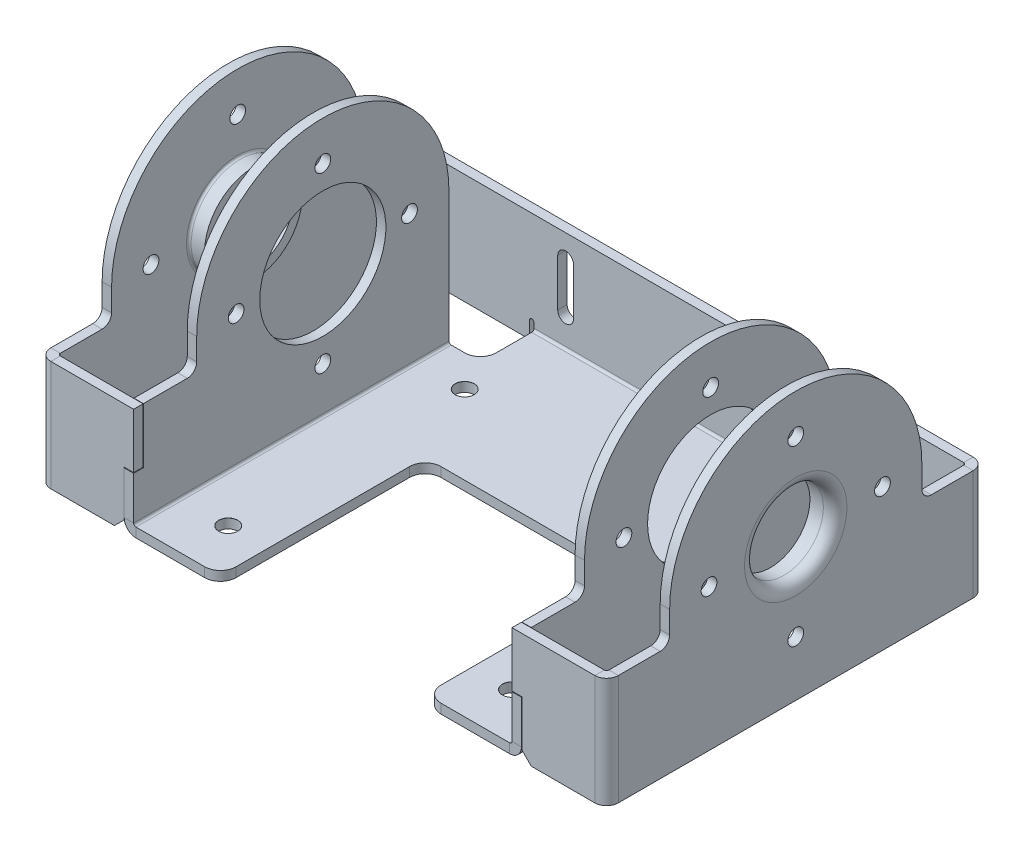
from build123d import *

# Parameters (mm, degrees)
SKETCH2_R                         = 12.5
BASE_FLANGE1_DEPTH                = 3
EDGE_FLANGE1_STRIP_W              = 13.4732
EDGE_FLANGE1_STRIP_H              = 3
EDGE_FLANGE1_STRIP_CUT_DEPTH      = 35
EDGE_FLANGE1_DEPTH                = 35
EDGE_FLANGE2_STRIP_W              = 13.4732
EDGE_FLANGE2_STRIP_H              = 3
EDGE_FLANGE2_STRIP_CUT_DEPTH      = 35
EDGE_FLANGE2_DEPTH                = 35
EDGE_FLANGE3_DEPTH                = 51.5
EDGE_FLANGE3_2_DEPTH              = 50
EDGE_FLANGE3_START                = -61
EDGE_FLANGE3_3_DEPTH              = 4.7366
BASE_FLANGE2_START                = -3
SKETCH16_R                        = 20
BASE_FLANGE2_DEPTH                = 3
SKETCH19_W                        = 3
SKETCH19_H                        = 17.5
CUT_EXTRUDE1_DEPTH                = 10
SKETCH20_W                        = 3
SKETCH20_H                        = 17.5
CUT_EXTRUDE2_DEPTH                = 3
MOVE_FACE1_BY                     = 0.1
MOVE_FACE1_2_BY                   = 0.1
MOVE_FACE2_BY                     = 0.1
MOVE_FACE2_2_BY                   = 0.1
EDGE_FLANGE4_STRIP_W              = 13.4732
EDGE_FLANGE4_STRIP_H              = 3
EDGE_FLANGE4_STRIP_CUT_DEPTH      = 100
EDGE_FLANGE4_DEPTH                = 100
SKETCH34_W                        = 65
SKETCH34_H                        = 65
CUT_EXTRUDE3_DEPTH                = 3
F_6_0_6_DIAMETER_HOLE1_AT_2_COUNT = 2
F_6_0_6_DIAMETER_HOLE1_AT_2_PITCH = 75
F_6_0_6_DIAMETER_HOLE1_AT_3_COUNT = 2
F_6_0_6_DIAMETER_HOLE1_AT_3_PITCH = 117.153745139
F_6_0_6_DIAMETER_HOLE1_AT_4_COUNT = 2
F_6_0_6_DIAMETER_HOLE1_AT_4_PITCH = 90
CUT_EXTRUDE4_DEPTH                = 3
SKETCH44_R                        = 2.5
CUT_EXTRUDE5_DEPTH                = 208.906228863
CIRPATTERN1_COUNT                 = 4
BREAK_CORNER1_START               = -1
BREAK_CORNER1_DEPTH               = 5
BREAK_CORNER1_2_DEPTH             = 3
BREAK_CORNER2_START               = -90
BREAK_CORNER2_DEPTH               = 3
BREAK_CORNER2_START_2             = 87
BREAK_CORNER2_2_DEPTH             = 3
BREAK_CORNER2_START_3             = -63
BREAK_CORNER2_3_DEPTH             = 3
BREAK_CORNER2_START_4             = 60
BREAK_CORNER2_4_DEPTH             = 3
BREAK_CORNER3_START               = 56
BREAK_CORNER3_DEPTH               = 5


with BuildPart() as part:
    # Base-Flange1: sheet metal written as solids
    # Sketch2 → Base-Flange1 (new body)
    with BuildSketch(Plane(origin=(90, 0, 0), x_dir=(0, 0, -1), z_dir=(1, 0, 0))):
        with BuildLine():
            Line((-60, 0), (60, 0))
            Line((60, 0), (60, 35))
            Line((60, 35), (40, 35))
            Line((40, 35), (40, 45))
            ThreePointArc((40, 45), (0, 85), (-40, 45))
            Line((-40, 45), (-40, 35))
            Line((-40, 35), (-60, 35))
            Line((-60, 35), (-60, 0))
        make_face()
        with Locations((0, 45)):
            Circle(SKETCH2_R, mode=Mode.SUBTRACT)
    extrude(amount=-BASE_FLANGE1_DEPTH)

    # Edge-Flange1: sheet metal written as solids
    # Edge-Flange1 strip (on a plane across the edge) → Edge-Flange1 strip cut (cut)
    with BuildSketch(Plane(origin=(87, 35, -60), x_dir=(0, 0, 1), z_dir=(0, -1, 0))):
        with Locations((-3, -1.5)):
            Rectangle(EDGE_FLANGE1_STRIP_W, EDGE_FLANGE1_STRIP_H)
    extrude(amount=EDGE_FLANGE1_STRIP_CUT_DEPTH, mode=Mode.SUBTRACT)

    # Edge-Flange1 section (on a plane across the edge) → Edge-Flange1 (add)
    with BuildSketch(Plane(origin=(87, 35, -60), x_dir=(0, 0, 1), z_dir=(0, -1, 0))):
        with BuildLine():
            Line((0, 0.7366), (0, 87))
            Line((0, 87), (3, 87))
            Line((3, 87), (3, 0.7366))
            ThreePointArc((3, 0.7366), (3.215745145, 0.215745145), (3.7366, 0))
            Line((3.7366, 0), (3.7366, -3))
            ThreePointArc((3.7366, -3), (1.094424801, -1.905575199), (0, 0.7366))
        make_face()
    extrude(amount=EDGE_FLANGE1_DEPTH)

    # Edge-Flange2: sheet metal written as solids
    # Edge-Flange2 strip (on a plane across the edge) → Edge-Flange2 strip cut (cut)
    with BuildSketch(Plane(origin=(87, 0, 60), x_dir=(0, 0, -1), z_dir=(0, 1, 0))):
        with Locations((-3, -1.5)):
            Rectangle(EDGE_FLANGE2_STRIP_W, EDGE_FLANGE2_STRIP_H)
    extrude(amount=EDGE_FLANGE2_STRIP_CUT_DEPTH, mode=Mode.SUBTRACT)

    # Edge-Flange2 section (on a plane across the edge) → Edge-Flange2 (add)
    with BuildSketch(Plane(origin=(87, 0, 60), x_dir=(0, 0, -1), z_dir=(0, 1, 0))):
        with BuildLine():
            Line((0, 0.7366), (0, 27))
            Line((0, 27), (3, 27))
            Line((3, 27), (3, 0.7366))
            ThreePointArc((3, 0.7366), (3.215745145, 0.215745145), (3.7366, 0))
            Line((3.7366, 0), (3.7366, -3))
            ThreePointArc((3.7366, -3), (1.094424801, -1.905575199), (0, 0.7366))
        make_face()
    extrude(amount=EDGE_FLANGE2_DEPTH)

    # Edge-Flange3: read off the stored shape, not the designer's step
    # Edge-Flange3 outline → Edge-Flange3 (cut)
    with BuildSketch(Plane.YZ):
        with BuildLine():
            ThreePointArc((3.7366, -60), (1.369132999, -59.154295979), (0.073322778, -57))
            Line((0.073322778, -57), (0, -57))
            Line((0, -57), (0, -60))
            Line((0, -60), (3.7366, -60))
        make_face()
    extrude(amount=EDGE_FLANGE3_DEPTH, mode=Mode.SUBTRACT)

    # Edge-Flange3 2 outline → Edge-Flange3 2 (add)
    with BuildSketch(Plane.YZ):
        with BuildLine():
            Line((0, 60), (0, -56.2634))
            ThreePointArc((0, -56.2634), (0.018375879, -56.63352018), (0.073322778, -57))
            Line((0.073322778, -57), (3.7366, -57))
            ThreePointArc((3.7366, -57), (3.215745145, -56.784254855), (3, -56.2634))
            Line((3, -56.2634), (3, 60))
            Line((3, 60), (0, 60))
        make_face()
    extrude(amount=EDGE_FLANGE3_2_DEPTH)

    # Edge-Flange3 3 outline → Edge-Flange3 3 (cut)
    with BuildSketch(Plane.XY.offset(EDGE_FLANGE3_START)):
        with BuildLine():
            Line((51.5, -1), (51.5, 5.2366))
            ThreePointArc((51.5, 5.2366), (50.75, 5.9866), (50, 5.2366))
            Line((50, 5.2366), (50, -1))
            Line((50, -1), (51.5, -1))
        make_face()
    extrude(amount=EDGE_FLANGE3_3_DEPTH, mode=Mode.SUBTRACT)

    # Sketch20 → Cut-Extrude2 (cut)
    with BuildSketch(Plane.XY.offset(60)):
        with Locations((61.5, 8.75)):
            Rectangle(SKETCH20_W, SKETCH20_H)
    extrude(amount=-CUT_EXTRUDE2_DEPTH, mode=Mode.SUBTRACT)

    # Move Face2: a face moved inward by 0.1
    extrude(part.faces().sort_by_distance((63, 8.75, 58.5))[0], amount=MOVE_FACE2_BY, dir=(1, 0, 0), mode=Mode.SUBTRACT)

    # Move Face2 2: a face moved inward by 0.1
    extrude(part.faces().sort_by_distance((61.5, 17.5, 58.5))[0], amount=MOVE_FACE2_2_BY, dir=(0, 1, 0), mode=Mode.SUBTRACT)


with BuildPart() as body_2:
    # Base-Flange2: sheet metal written as solids
    # Sketch16 → Base-Flange2 (new body)
    with BuildSketch(Plane.ZY.offset(-60).offset(BASE_FLANGE2_START)):
        with BuildLine():
            Line((60, 0), (-40, 0))
            Line((-40, 0), (-40, 45))
            ThreePointArc((-40, 45), (0, 85), (40, 45))
            Line((40, 45), (40, 35))
            Line((40, 35), (60, 35))
            Line((60, 35), (60, 0))
        make_face()
        with Locations((0, 45)):
            Circle(SKETCH16_R, mode=Mode.SUBTRACT)
    extrude(amount=BASE_FLANGE2_DEPTH)

    # Sketch19 → Cut-Extrude1 (cut)
    with BuildSketch(Plane.ZY.offset(-60)):
        with Locations((58.5, 26.25)):
            Rectangle(SKETCH19_W, SKETCH19_H)
    extrude(amount=-CUT_EXTRUDE1_DEPTH, mode=Mode.SUBTRACT)

    # Move Face1: a face moved inward by 0.1
    extrude(body_2.faces().sort_by_distance((61.5, 17.5, 58.5))[0], amount=MOVE_FACE1_BY, dir=(0, -1, 0), mode=Mode.SUBTRACT)

    # Move Face1 2: a face moved inward by 0.1
    extrude(body_2.faces().sort_by_distance((61.5, 26.25, 57))[0], amount=MOVE_FACE1_2_BY, dir=(0, 0, -1), mode=Mode.SUBTRACT)

    # Edge-Flange4: sheet metal written as solids
    # Edge-Flange4 strip (on a plane across the edge) → Edge-Flange4 strip cut (cut)
    with BuildSketch(Plane(origin=(60, 0, -40), x_dir=(0, 1, 0), z_dir=(0, 0, 1))):
        with Locations((-3, -1.5)):
            Rectangle(EDGE_FLANGE4_STRIP_W, EDGE_FLANGE4_STRIP_H)
    extrude(amount=EDGE_FLANGE4_STRIP_CUT_DEPTH, mode=Mode.SUBTRACT)

    # Edge-Flange4 section (on a plane across the edge) → Edge-Flange4 (add)
    with BuildSketch(Plane(origin=(60, 0, -40), x_dir=(0, 1, 0), z_dir=(0, 0, 1))):
        with BuildLine():
            Line((0, 0.7366), (0, 27))
            Line((0, 27), (3, 27))
            Line((3, 27), (3, 0.7366))
            ThreePointArc((3, 0.7366), (3.215745145, 0.215745145), (3.7366, 0))
            Line((3.7366, 0), (3.7366, -3))
            ThreePointArc((3.7366, -3), (1.094424801, -1.905575199), (0, 0.7366))
        make_face()
    extrude(amount=EDGE_FLANGE4_DEPTH)

    # Combine1: union part
    add(part.part)


with BuildPart() as body_2_2:
    # Mirror1: mirrored copy
    add(body_2.part.mirror(Plane(origin=(0, 0, 0), x_dir=(0, 0, 1), z_dir=(1, 0, 0))))

    # Combine2: union body 2
    add(body_2.part)

    # Sketch34 → Cut-Extrude3 (cut)
    with BuildSketch(Plane(origin=(0, 3, 0), x_dir=(1, 0, 0), z_dir=(0, 1, 0))):
        with Locations((0, -27.5)):
            Rectangle(SKETCH34_W, SKETCH34_H)
    extrude(amount=-CUT_EXTRUDE3_DEPTH, mode=Mode.SUBTRACT)

    # Sketch36 → Ø6.0 (6) Diameter Hole1 (revolve, cut)
    with BuildSketch(Plane(origin=(-45, 3, 45), x_dir=(0, 0, 1), z_dir=(1, 0, 0))):
        Polygon((0, 0), (0, 3), (3, 3), (3, 0.025), (3.025, 0), align=None)
    f_6_0_6_diameter_hole1 = revolve(axis=Axis((-45, 9.35, 45), (0, -1, 0)), mode=Mode.SUBTRACT)

    # Ø6.0 (6) Diameter Hole1 at 2: Ø6.0 (6) Diameter Hole1 ×2
    with Locations(*[(0, 0, -i * F_6_0_6_DIAMETER_HOLE1_AT_2_PITCH) for i in range(1, F_6_0_6_DIAMETER_HOLE1_AT_2_COUNT)]):
        add(f_6_0_6_diameter_hole1, mode=Mode.SUBTRACT)

    # Ø6.0 (6) Diameter Hole1 at 3: Ø6.0 (6) Diameter Hole1 ×2
    with Locations(*[Vector(0.7682212795973759, -3.070429029417624e-15, -0.6401843996644798) * (i * F_6_0_6_DIAMETER_HOLE1_AT_3_PITCH) for i in range(1, F_6_0_6_DIAMETER_HOLE1_AT_3_COUNT)]):
        add(f_6_0_6_diameter_hole1, mode=Mode.SUBTRACT)

    # Ø6.0 (6) Diameter Hole1 at 4: Ø6.0 (6) Diameter Hole1 ×2
    with Locations(*[(i * F_6_0_6_DIAMETER_HOLE1_AT_4_PITCH, 0, 0) for i in range(1, F_6_0_6_DIAMETER_HOLE1_AT_4_COUNT)]):
        add(f_6_0_6_diameter_hole1, mode=Mode.SUBTRACT)

    # Sketch37 → Cut-Extrude4 (cut)
    with BuildSketch(Plane.XY.offset(-57)):
        with BuildLine():
            Line((-42.5, 12.5), (-42.5, 27.5))
            ThreePointArc((-42.5, 27.5), (-40, 30), (-37.5, 27.5))
            Line((-37.5, 27.5), (-37.5, 12.5))
            ThreePointArc((-37.5, 12.5), (-40, 10), (-42.5, 12.5))
        make_face()
        with BuildLine():
            Line((42.5, 12.5), (42.5, 27.5))
            ThreePointArc((42.5, 27.5), (40, 30), (37.5, 27.5))
            Line((37.5, 27.5), (37.5, 12.5))
            ThreePointArc((37.5, 12.5), (40, 10), (42.5, 12.5))
        make_face()
    extrude(amount=-CUT_EXTRUDE4_DEPTH, mode=Mode.SUBTRACT)

    # Edge-Flange5: read off the stored shape, not the designer's step
    # Edge-Flange5 outline → Edge-Flange5 (revolve, cut)
    with BuildSketch(Plane(origin=(0, 45, 0), x_dir=(0, 1, 0), z_dir=(0, 0, -1))):
        with BuildLine():
            Line((12.5, 87), (12.573322778, 87))
            ThreePointArc((12.573322778, 87), (13.869132999, 89.154295979), (16.2366, 90))
            Line((16.2366, 90), (12.5, 90))
            Line((12.5, 90), (12.5, 87))
        make_face()
    revolve(axis=Axis((0, 45, 0), (1, 0, 0)), mode=Mode.SUBTRACT)

    # Edge-Flange5 2 outline → Edge-Flange5 2 (revolve)
    with BuildSketch(Plane(origin=(0, 45, 0), x_dir=(0, 1, 0), z_dir=(0, 0, -1))):
        with BuildLine():
            Line((12.5, 86.2634), (12.5, 82))
            Line((12.5, 82), (15.5, 82))
            Line((15.5, 82), (15.5, 86.2634))
            ThreePointArc((15.5, 86.2634), (15.715745145, 86.784254855), (16.2366, 87))
            Line((16.2366, 87), (12.573322778, 87))
            ThreePointArc((12.573322778, 87), (12.518375879, 86.63352018), (12.5, 86.2634))
        make_face()
    revolve(axis=Axis((0, 45, 0), (1, 0, 0)))

    # Edge-Flange6: read off the stored shape, not the designer's step
    # Edge-Flange6 outline → Edge-Flange6 (revolve, cut)
    with BuildSketch(Plane(origin=(0, 45, 0), x_dir=(0, 1, 0), z_dir=(0, 0, -1))):
        with BuildLine():
            ThreePointArc((16.2366, -90), (13.869132999, -89.154295979), (12.573322778, -87))
            Line((12.573322778, -87), (12.5, -87))
            Line((12.5, -87), (12.5, -90))
            Line((12.5, -90), (16.2366, -90))
        make_face()
    revolve(axis=Axis((0, 45, 0), (1, 0, 0)), mode=Mode.SUBTRACT)

    # Edge-Flange6 2 outline → Edge-Flange6 2 (revolve)
    with BuildSketch(Plane(origin=(0, 45, 0), x_dir=(0, 1, 0), z_dir=(0, 0, -1))):
        with BuildLine():
            Line((12.573322778, -87), (16.2366, -87))
            ThreePointArc((16.2366, -87), (15.715745145, -86.784254855), (15.5, -86.2634))
            Line((15.5, -86.2634), (15.5, -82))
            Line((15.5, -82), (12.5, -82))
            Line((12.5, -82), (12.5, -86.2634))
            ThreePointArc((12.5, -86.2634), (12.518375879, -86.63352018), (12.573322778, -87))
        make_face()
    revolve(axis=Axis((0, 45, 0), (1, 0, 0)))

    # Sketch44 → Cut-Extrude5 (cut, through all)
    with BuildSketch(Plane(origin=(90, 0, 0), x_dir=(0, 0, -1), z_dir=(1, 0, 0))):
        with Locations((0, 72.5)):
            Circle(SKETCH44_R)
    cut_extrude5 = extrude(amount=-CUT_EXTRUDE5_DEPTH, mode=Mode.SUBTRACT)

    # CirPattern1: Cut-Extrude5 ×4 about axis
    cirpattern1_axis = Axis((0, 45, 0), (1, 0, 0))
    for i in range(1, CIRPATTERN1_COUNT):
        add(cut_extrude5.rotate(cirpattern1_axis, i * 360 / CIRPATTERN1_COUNT), mode=Mode.SUBTRACT)

    # Break-Corner1: read off the stored shape, not the designer's step
    # Break-Corner1 outline → Break-Corner1 (cut)
    with BuildSketch(Plane(origin=(0, 0, 0), x_dir=(1, 0, 0), z_dir=(0, 1, 0)).offset(BREAK_CORNER1_START)):
        with BuildLine():
            Line((-32.5, -60), (-32.5, -55))
            ThreePointArc((-32.5, -55), (-33.964466094, -58.535533906), (-37.5, -60))
            Line((-37.5, -60), (-32.5, -60))
        make_face()
        with BuildLine():
            ThreePointArc((37.5, -60), (33.964466094, -58.535533906), (32.5, -55))
            Line((32.5, -55), (32.5, -60))
            Line((32.5, -60), (37.5, -60))
        make_face()
    extrude(amount=BREAK_CORNER1_DEPTH, mode=Mode.SUBTRACT)

    # Break-Corner1 2 outline → Break-Corner1 2 (add)
    with BuildSketch(Plane(origin=(0, 0, 0), x_dir=(1, 0, 0), z_dir=(0, 1, 0))):
        with BuildLine():
            ThreePointArc((55, 40), (51.464466094, 41.464466094), (50, 45))
            Line((50, 45), (50, 40))
            Line((50, 40), (55, 40))
        make_face()
        with BuildLine():
            ThreePointArc((-50, 45), (-51.464466094, 41.464466094), (-55, 40))
            Line((-55, 40), (-50, 40))
            Line((-50, 40), (-50, 45))
        make_face()
        with BuildLine():
            Line((32.5, 5), (27.5, 5))
            ThreePointArc((27.5, 5), (31.035533906, 3.535533906), (32.5, 0))
            Line((32.5, 0), (32.5, 5))
        make_face()
        with BuildLine():
            ThreePointArc((-32.5, 0), (-31.035533906, 3.535533906), (-27.5, 5))
            Line((-27.5, 5), (-32.5, 5))
            Line((-32.5, 5), (-32.5, 0))
        make_face()
    extrude(amount=BREAK_CORNER1_2_DEPTH)

    # Break-Corner2: read off the stored shape, not the designer's step
    # Break-Corner2 outline → Break-Corner2 (add)
    with BuildSketch(Plane.YZ.offset(BREAK_CORNER2_START)):
        with BuildLine():
            ThreePointArc((38, 40), (35.878679656, 40.878679656), (35, 43))
            Line((35, 43), (35, 40))
            Line((35, 40), (38, 40))
        make_face()
        with BuildLine():
            ThreePointArc((35, -43), (35.878679656, -40.878679656), (38, -40))
            Line((38, -40), (35, -40))
            Line((35, -40), (35, -43))
        make_face()
    extrude(amount=BREAK_CORNER2_DEPTH)

    # Break-Corner2 2 outline → Break-Corner2 2 (add)
    with BuildSketch(Plane.YZ.offset(BREAK_CORNER2_START_2)):
        with BuildLine():
            ThreePointArc((38, 40), (35.878679656, 40.878679656), (35, 43))
            Line((35, 43), (35, 40))
            Line((35, 40), (38, 40))
        make_face()
        with BuildLine():
            ThreePointArc((35, -43), (35.878679656, -40.878679656), (38, -40))
            Line((38, -40), (35, -40))
            Line((35, -40), (35, -43))
        make_face()
    extrude(amount=BREAK_CORNER2_2_DEPTH)

    # Break-Corner2 3 outline → Break-Corner2 3 (add)
    with BuildSketch(Plane.YZ.offset(BREAK_CORNER2_START_3)):
        with BuildLine():
            ThreePointArc((38, 40), (35.878679656, 40.878679656), (35, 43))
            Line((35, 43), (35, 40))
            Line((35, 40), (38, 40))
        make_face()
    extrude(amount=BREAK_CORNER2_3_DEPTH)

    # Break-Corner2 4 outline → Break-Corner2 4 (add)
    with BuildSketch(Plane.YZ.offset(BREAK_CORNER2_START_4)):
        with BuildLine():
            ThreePointArc((38, 40), (35.878679656, 40.878679656), (35, 43))
            Line((35, 43), (35, 40))
            Line((35, 40), (38, 40))
        make_face()
    extrude(amount=BREAK_CORNER2_4_DEPTH)

    # Break-Corner3: read off the stored shape, not the designer's step
    # Break-Corner3 outline → Break-Corner3 (cut)
    with BuildSketch(Plane.XY.offset(BREAK_CORNER3_START)):
        Polygon((66.1, 0), (63.1, 3), (63.1, 0), align=None)
        Polygon((-63.1, 3), (-66.1, 0), (-63.1, 0), align=None)
    extrude(amount=BREAK_CORNER3_DEPTH, mode=Mode.SUBTRACT)


solid = body_2_2.part
